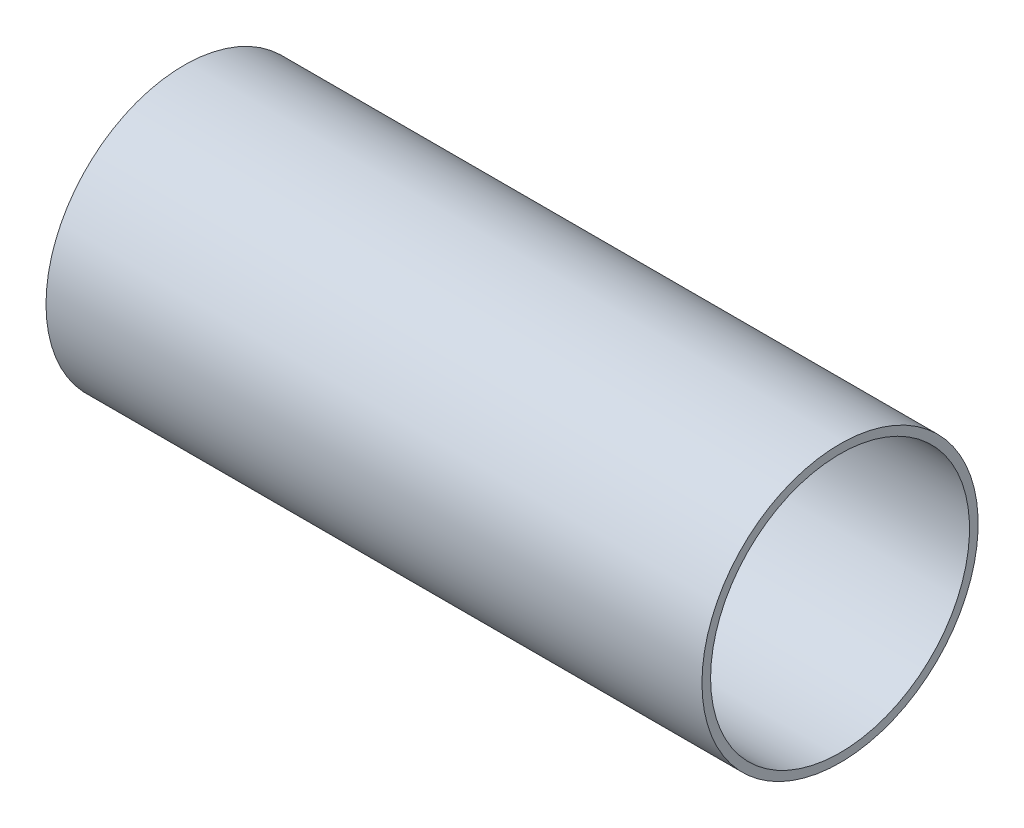
from build123d import *

# Parameters (mm, degrees)
SKETCH1_R           = 101.6
SKETCH1_R_2         = 95.25
BOSS_EXTRUDE1_DEPTH = 482.6


with BuildPart() as part:
    # Sketch1 → Boss-Extrude1 (new body)
    with BuildSketch(Plane(origin=(0, 0, 0), x_dir=(0, 0, -1), z_dir=(1, 0, 0))):
        Circle(SKETCH1_R)
        Circle(SKETCH1_R_2, mode=Mode.SUBTRACT)
    extrude(amount=BOSS_EXTRUDE1_DEPTH)


solid = part.part
